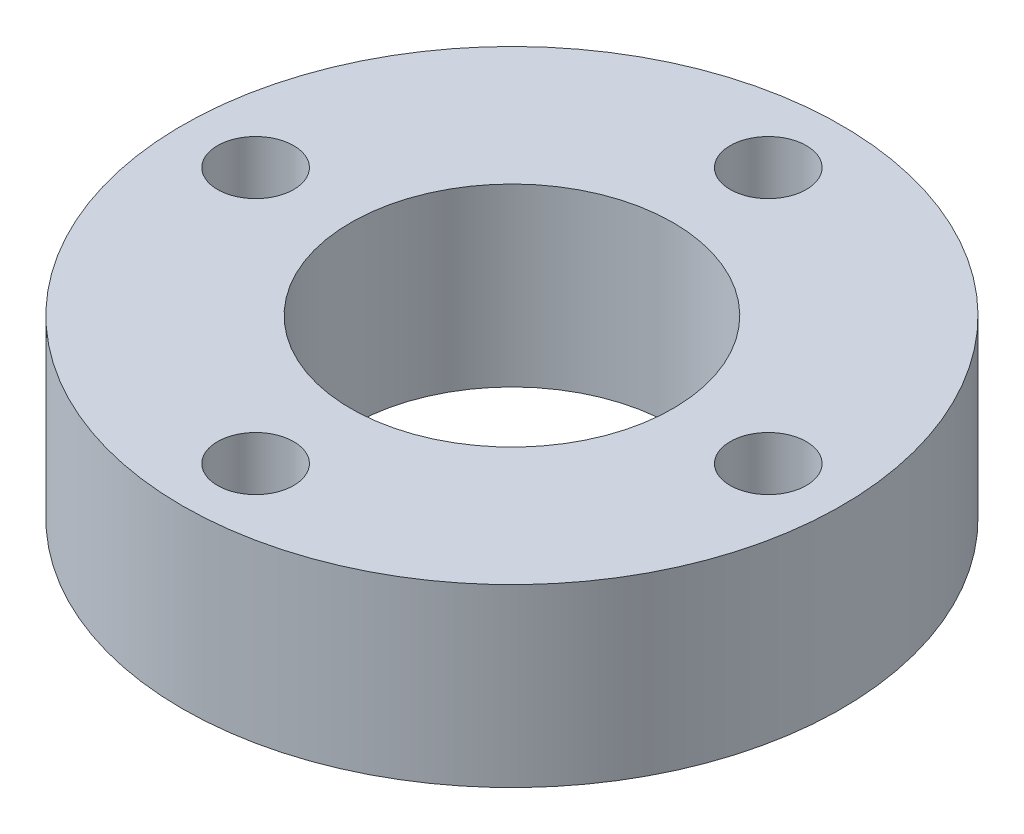
from build123d import *

# Parameters (mm, degrees)
SKETCH_1_R          = 22.5
EXTRUDE_1_DEPTH     = 12
SKETCH_2_R          = 4.2
CUT_EXTRUDE_1_DEPTH = 4.4
SKETCH_3_R          = 2.6
CUT_EXTRUDE_2_DEPTH = 35.007352146
SKETCH_4_R          = 4
CUT_EXTRUDE_3_DEPTH = 35.007352146
SKETCH_5_R          = 11
CUT_EXTRUDE_4_DEPTH = 35.007352146


with BuildPart() as part:
    # 草图1 → 凸台-拉伸1 (new body)
    with BuildSketch(Plane(origin=(0, 0, 0), x_dir=(1, 0, 0), z_dir=(0, 1, 0))):
        Circle(SKETCH_1_R)
    extrude(amount=EXTRUDE_1_DEPTH)

    # 草图2 → 切除-拉伸1 (cut)
    with BuildSketch(Plane.XZ):
        with Locations((17.5, 0)):
            Circle(SKETCH_2_R)
        with Locations((0, 17.5)):
            Circle(SKETCH_2_R)
        with Locations((0, -17.5)):
            Circle(SKETCH_2_R)
        with Locations((-17.5, 0)):
            Circle(SKETCH_2_R)
    extrude(amount=-CUT_EXTRUDE_1_DEPTH, mode=Mode.SUBTRACT)

    # 草图3 → 切除-拉伸2 (cut, through all)
    with BuildSketch(Plane.XZ):
        with Locations((0, 17.5)):
            Circle(SKETCH_3_R)
        with Locations((17.5, 0)):
            Circle(SKETCH_3_R)
        with Locations((0, -17.5)):
            Circle(SKETCH_3_R)
        with Locations((-17.5, 0)):
            Circle(SKETCH_3_R)
    extrude(amount=-CUT_EXTRUDE_2_DEPTH, mode=Mode.SUBTRACT)

    # 草图4 → 切除-拉伸3 (cut, through all)
    with BuildSketch(Plane.XZ):
        Circle(SKETCH_4_R)
    extrude(amount=-CUT_EXTRUDE_3_DEPTH, mode=Mode.SUBTRACT)

    # 草图5 → 切除-拉伸4 (cut, through all)
    with BuildSketch(Plane.XZ):
        Circle(SKETCH_5_R)
    extrude(amount=-CUT_EXTRUDE_4_DEPTH, mode=Mode.SUBTRACT)


solid = part.part
